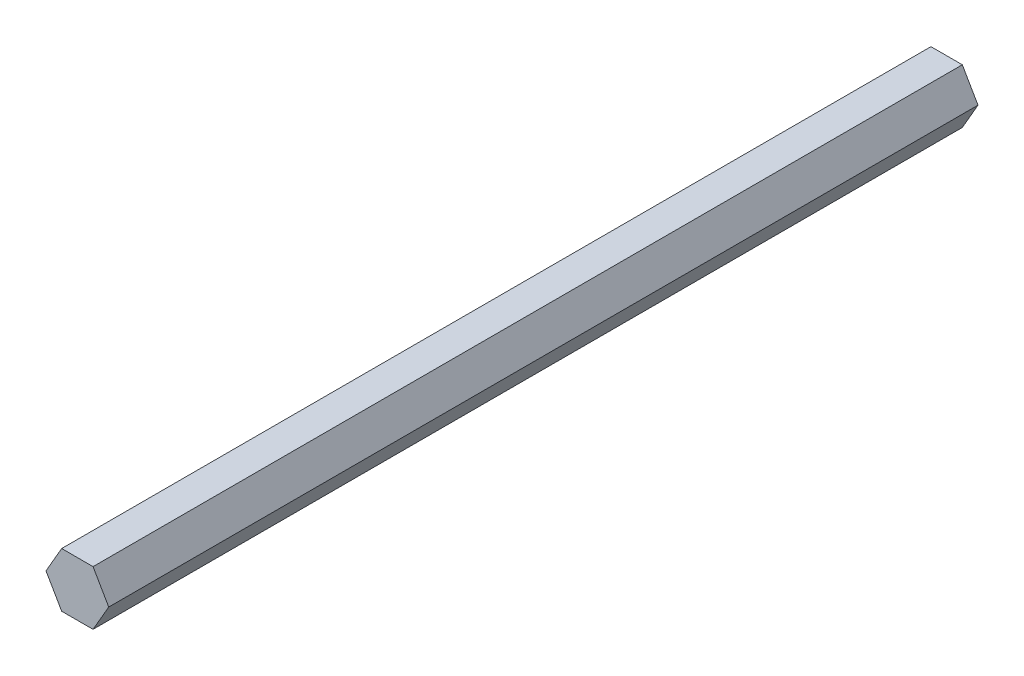
from build123d import *

# Parameters (mm, degrees)
BOSS_EXTRUDE1_DEPTH = 203.2


with BuildPart() as part:
    # Sketch1 → Boss-Extrude1 (new body)
    with BuildSketch(Plane.XY):
        Polygon((-7.332348419, 0), (-3.666174209, -6.35), (3.666174209, -6.35), (7.332348419, 0), (3.666174209, 6.35), (-3.666174209, 6.35), align=None)
    extrude(amount=BOSS_EXTRUDE1_DEPTH)


solid = part.part
